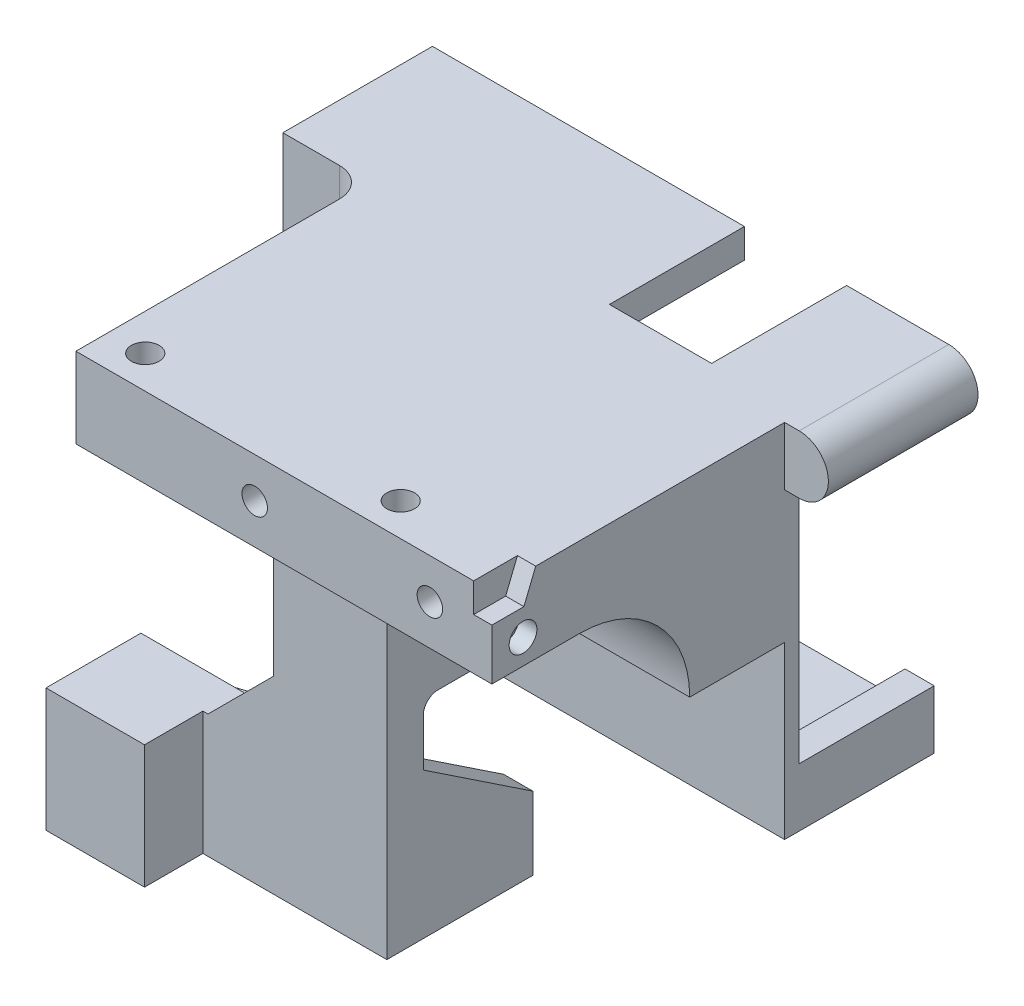
from build123d import *

# Parameters (mm, degrees)
RESSALTO_EXTRUS_O1_DEPTH  = 5
RESSALTO_EXTRUS_O2_DEPTH  = 15.5
RESSALTO_EXTRUS_O3_DEPTH  = 15.5
RESSALTO_EXTRUS_O4_DEPTH  = 20
ESBO_O6_W                 = 5
ESBO_O6_H                 = 16.897720337
RESSALTO_EXTRUS_O5_DEPTH  = 23.2
ESBO_O7_W                 = 13.499987793
ESBO_O7_H                 = 16.897720337
RESSALTO_EXTRUS_O6_DEPTH  = 8
ESBO_O8_W                 = 2.000000014
ESBO_O8_H                 = 6.588073731
CORTE_EXTRUS_O1_DEPTH     = 93.188310305
CHANFRO2_SIZE             = 9
RESSALTO_EXTRUS_O8_DEPTH  = 4.5
RESSALTO_EXTRUS_O7_START  = -5.5
RESSALTO_EXTRUS_O7_DEPTH  = 6
CORTE_EXTRUS_O2_REACH     = 102.674
ESBO_O11_W                = 11.999984741
ESBO_O11_H                = 13.640792847
CORTE_EXTRUS_O4_REACH     = 108.65
ESBO_O13_R                = 1.6
RESSALTO_EXTRUS_O9_DEPTH  = 5
ESBO_O16_W                = 11.500915527
ESBO_O16_H                = 13.642723083
CORTE_EXTRUS_O5_DEPTH     = 101.673633611
RESSALTO_EXTRUS_O13_START = -15.5
ESBO_O18_W                = 32.102264404
ESBO_O18_H                = 11
RESSALTO_EXTRUS_O13_DEPTH = 77.5
ESBO_O27_W                = 32.102264404
ESBO_O27_H                = 11
CORTE_EXTRUS_O8_DEPTH     = 20.5
ESBO_O29_R                = 1.9
CORTE_EXTRUS_O9_DEPTH     = 2.5
ESBO_O30_R                = 1.9
CORTE_EXTRUS_O10_DEPTH    = 6
ESBO_O32_W                = 20
ESBO_O32_H                = 78
CORTE_EXTRUS_O11_DEPTH    = 88.462468019
ESBO_O33_R                = 1.75
CORTE_EXTRUS_O12_DEPTH    = 26
CORTE_EXTRUS_O13_START    = -6
CORTE_EXTRUS_O13_DEPTH    = 2.9
RESSALTO_EXTRUS_O20_DEPTH = 10
ESBO_O40_W                = 68.75
ESBO_O40_H                = 49.5
ESBO_O40_W_2              = 60.75
ESBO_O40_H_2              = 41.5
RESSALTO_EXTRUS_O21_DEPTH = 18.5
ESBO_O41_W                = 11.75
ESBO_O41_H                = 49.5
ESBO_O41_W_2              = 41.5
ESBO_O41_H_2              = 38.5
RESSALTO_EXTRUS_O22_DEPTH = 2
RESSALTO_EXTRUS_O23_DEPTH = 15.5
ESBO_O43_W                = 4
ESBO_O43_H                = 33.5
ESBO_O43_W_2              = 14
ESBO_O43_H_2              = 4
CORTE_EXTRUS_O14_DEPTH    = 18.5
RESSALTO_EXTRUS_O24_DEPTH = 20.5
ESBO_O45_R                = 1.8
CORTE_EXTRUS_O15_DEPTH    = 6
FILETE1_R                 = 4
FILETE2_R                 = 2


with BuildPart() as part:
    # Esboço2 → Ressalto-extrusão1 (new body)
    with BuildSketch(Plane.XY):
        Polygon((0, 0), (0, -60.9), (-20, -60.9), (-20, -25.9), (-15.5, -15.9), (-15.5, 0), align=None)
    extrude(amount=RESSALTO_EXTRUS_O1_DEPTH)

    # Esboço3 → Ressalto-extrusão2 (add)
    with BuildSketch(Plane(origin=(0, 0, 0), x_dir=(0, 0, -1), z_dir=(1, 0, 0))):
        with BuildLine():
            ThreePointArc((6.102294922, 14.1), (-2.871049482, 9.744626932), (-5, 0))
            Line((-5, 0), (0, 0))
            ThreePointArc((0, 0), (1.788130128, 4.313492501), (6.102294922, 6.1))
            Line((6.102294922, 6.1), (30.102294922, 6.1))
            ThreePointArc((30.102294922, 6.099999986), (40.781022689, 1.676452573), (45.204559313, -9.002279663))
            Line((45.204559326, -9.002279663), (45.204559326, -60.9))
            Line((45.204559326, -60.9), (50.204559326, -60.9))
            Line((50.204559326, -60.9), (50.204559326, 14.1))
            Line((50.204559326, 14.1), (6.102294922, 14.1))
        make_face()
    extrude(amount=-RESSALTO_EXTRUS_O2_DEPTH)

    # Esboço4 → Ressalto-extrusão3 (add)
    with BuildSketch(Plane.ZY.offset(15.5)):
        Polygon((-50.204559326, -60.9), (-50.204559326, -40.9), (-65.204559326, -50.9), (-65.204559326, -60.9), align=None)
    extrude(amount=-RESSALTO_EXTRUS_O3_DEPTH)

    # Esboço5 → Ressalto-extrusão4 (add)
    with BuildSketch(Plane.ZY.offset(20)):
        Polygon((5, -60.9), (20, -60.9), (20, -50.9), (5, -40.9), align=None)
    extrude(amount=-RESSALTO_EXTRUS_O4_DEPTH)

    # Esboço6 → Ressalto-extrusão5 (add)
    with BuildSketch(Plane.ZY.offset(15.5)):
        with Locations((-47.704559326, -52.451139832)):
            Rectangle(ESBO_O6_W, ESBO_O6_H)
    extrude(amount=RESSALTO_EXTRUS_O5_DEPTH)

    # Esboço7 → Ressalto-extrusão6 (add)
    with BuildSketch(Plane.XY.offset(-45.204559326)):
        with Locations((-31.950006104, -52.451139832)):
            Rectangle(ESBO_O7_W, ESBO_O7_H)
    extrude(amount=RESSALTO_EXTRUS_O6_DEPTH)

    # Esboço8 → Corte-extrusão1 (cut, through all)
    with BuildSketch(Plane.ZY.offset(15.5)):
        with Locations((-46.204559319, -12.296316529)):
            Rectangle(ESBO_O8_W, ESBO_O8_H)
    extrude(amount=-CORTE_EXTRUS_O1_DEPTH, mode=Mode.SUBTRACT)

    # Chanfro2
    # the kernel refuses this chamfer: 9 mm, written as the material it adds along each edge
    with BuildSketch(Plane(origin=(-15.5, -44.002279663, -50.204559326), x_dir=(0.027495876610586407, 0.9996219169112969, 0), z_dir=(0, 0, 1))) as chanfro2_piece_1:
        Polygon((CHANFRO2_SIZE * 0.999621916911, CHANFRO2_SIZE * 0.0274958766106), (-CHANFRO2_SIZE * 0.0274958766106, CHANFRO2_SIZE * 0.999621916911), (0, 0), align=None)
    extrude(amount=5)

    # Esboço10 → Ressalto-extrusão8 (add)
    with BuildSketch(Plane.ZY.offset(15.5)):
        Polygon((-50.204559326, -40.9), (-50.204559326, -60.9), (-65.204559326, -60.9), (-65.204559326, -50.9), align=None)
    extrude(amount=RESSALTO_EXTRUS_O8_DEPTH)

    # Esboço9 → Ressalto-extrusão7 (add)
    with BuildSketch(Plane.XZ.offset(60.9).offset(RESSALTO_EXTRUS_O7_START)):
        Polygon((-38.7, -50.204559326), (-38.700004578, -53.204559326), (-20, -59.204559326), (-20, -50.204559326), align=None)
    extrude(amount=-RESSALTO_EXTRUS_O7_DEPTH)

    # Corte-extrusão2: up to this face of the body (flat: up to its plane)
    corte_extrus_o2_end = Plane(part.part.faces().sort_by_distance((-10, -45.9, 12.5))[0])
    # Esboço11 → Corte-extrusão2 (cut, up to the picked face)
    with BuildSketch(Plane.XY.offset(5), mode=Mode.PRIVATE) as corte_extrus_o2_sk1:
        with Locations((-10.00000763, -47.720396424)):
            Rectangle(ESBO_O11_W, ESBO_O11_H)
    corte_extrus_o2_tool1 = split(extrude(corte_extrus_o2_sk1.sketch, amount=CORTE_EXTRUS_O2_REACH, mode=Mode.PRIVATE), bisect_by=corte_extrus_o2_end, keep=Keep.BOTH, mode=Mode.PRIVATE)
    add(corte_extrus_o2_tool1.solids().sort_by(Axis((-10.000008, -47.720396, 5), (0, 0, 1)))[0], mode=Mode.SUBTRACT)

    # Esboço13 → Corte-extrusão4 (cut, up to next)
    with BuildSketch(Plane.XZ.offset(60.9), mode=Mode.PRIVATE) as corte_extrus_o4_sk1:
        with Locations(Location((-10, 12.5, 0), (0, 0, 270))):
            Circle(ESBO_O13_R)
    corte_extrus_o4_tool1 = extrude(corte_extrus_o4_sk1.sketch, amount=-CORTE_EXTRUS_O4_REACH, mode=Mode.PRIVATE) & part.part
    # Esboço13 → Corte-extrusão4 (cut, up to next)
    with BuildSketch(Plane.XZ.offset(60.9), mode=Mode.PRIVATE) as corte_extrus_o4_sk2:
        with Locations(Location((-9.7, -57.704559326, 0), (0, 0, 270))):
            Circle(ESBO_O13_R)
    corte_extrus_o4_tool2 = extrude(corte_extrus_o4_sk2.sketch, amount=-CORTE_EXTRUS_O4_REACH, mode=Mode.PRIVATE) & part.part
    add(corte_extrus_o4_tool1.solids().sort_by_distance((-10, -60.9, 12.5))[0], mode=Mode.SUBTRACT)
    add(corte_extrus_o4_tool2.solids().sort_by_distance((-9.7, -60.9, -57.704559))[0], mode=Mode.SUBTRACT)

    # Esboço14 → Ressalto-extrusão9 (add)
    with BuildSketch(Plane.XY.offset(5)):
        Polygon((-10.75, 0), (-4.75, 0), (-4.75, -15.9), (-7.000007629, -25.9), (-7.000007629, -40.9), (-13.000007629, -40.9), (-13.000007629, -25.9), (-10.75, -15.9), align=None)
    extrude(amount=RESSALTO_EXTRUS_O9_DEPTH)

    # Esboço16 → Corte-extrusão5 (cut, through all)
    with BuildSketch(Plane(origin=(0, 0, -50.204559326), x_dir=(-1, 0, 0), z_dir=(0, 0, -1))):
        with Locations((9.750457764, -47.721361542)):
            Rectangle(ESBO_O16_W, ESBO_O16_H)
    extrude(amount=CORTE_EXTRUS_O5_DEPTH, mode=Mode.SUBTRACT)

    # Esboço18 → Ressalto-extrusão13 (add)
    with BuildSketch(Plane(origin=(0, 0, 0), x_dir=(0, 0, -1), z_dir=(1, 0, 0)).offset(RESSALTO_EXTRUS_O13_START)):
        with Locations((34.153427124, 11.6)):
            Rectangle(ESBO_O18_W, ESBO_O18_H)
    extrude(amount=RESSALTO_EXTRUS_O13_DEPTH)

    # Esboço27 → Corte-extrusão8 (cut)
    with BuildSketch(Plane(origin=(62, 0, 0), x_dir=(0, 0, -1), z_dir=(1, 0, 0))):
        with Locations((34.153427124, 11.6)):
            Rectangle(ESBO_O27_W, ESBO_O27_H)
    extrude(amount=-CORTE_EXTRUS_O8_DEPTH, mode=Mode.SUBTRACT)

    # Esboço29 → Corte-extrusão9 (cut)
    with BuildSketch(Plane(origin=(41.5, 0, 0), x_dir=(0, 0, -1), z_dir=(1, 0, 0))):
        with Locations((22.364620491, 9.524231873)):
            Circle(ESBO_O29_R)
        Polygon((24.102294922, 17.1), (22.486408956, 13.10054189), (18.102294922, 13.10054189), (18.102294922, 17.1), align=None)
    extrude(amount=-CORTE_EXTRUS_O9_DEPTH, mode=Mode.SUBTRACT)

    # Esboço30 → Corte-extrusão10 (cut)
    with BuildSketch(Plane(origin=(0, 17.1, 0), x_dir=(1, 0, 0), z_dir=(0, 1, 0))):
        with Locations(Location((-10.5, 22.602294922, 0), (0, 0, 180))):
            Circle(ESBO_O30_R)
        with Locations(Location((24.5, 22.602294922, 0), (0, 0, 180))):
            Circle(ESBO_O30_R)
    extrude(amount=-CORTE_EXTRUS_O10_DEPTH, mode=Mode.SUBTRACT)

    # Esboço32 → Corte-extrusão11 (cut, through all)
    with BuildSketch(Plane.XY.offset(-18.102294922)):
        with Locations((-10, -21.9)):
            Rectangle(ESBO_O32_W, ESBO_O32_H)
    extrude(amount=CORTE_EXTRUS_O11_DEPTH, mode=Mode.SUBTRACT)

    # Esboço33 → Corte-extrusão12 (cut)
    with BuildSketch(Plane.XY.offset(-18.102294922)):
        with Locations((9, 11.6)):
            Circle(ESBO_O33_R)
        with Locations((33, 11.6)):
            Circle(ESBO_O33_R)
    extrude(amount=-CORTE_EXTRUS_O12_DEPTH, mode=Mode.SUBTRACT)

    # Esboço34 → Corte-extrusão13 (cut)
    with BuildSketch(Plane.XY.offset(-18.102294922).offset(CORTE_EXTRUS_O13_START)):
        Polygon((9, 15.179571669), (5.9, 13.389785834), (5.9, 9.810214166), (5.9, 6.1), (12.1, 6.1), (12.1, 9.810214166), (12.1, 13.389785834), align=None)
        Polygon((29.9, 6.1), (29.9, 9.810214166), (29.9, 13.389785834), (33, 15.179571669), (36.1, 13.389785834), (36.1, 9.810214166), (36.1, 6.1), align=None)
    extrude(amount=-CORTE_EXTRUS_O13_DEPTH, mode=Mode.SUBTRACT)

    # Esboço39 → Ressalto-extrusão20 (add)
    with BuildSketch(Plane(origin=(0, 0, -50.204559326), x_dir=(-1, 0, 0), z_dir=(0, 0, -1))):
        Polygon((-41.5, 17.1), (-41.5, 6.1), (0, 6.1), (0, -32.4), (15.5, -32.4), (15.5, 17.1), align=None)
    extrude(amount=RESSALTO_EXTRUS_O20_DEPTH)

    # Esboço40 → Ressalto-extrusão21 (add)
    with BuildSketch(Plane(origin=(0, 0, -60.204559326), x_dir=(-1, 0, 0), z_dir=(0, 0, -1))):
        with Locations((-7.125, -7.65)):
            Rectangle(ESBO_O40_W, ESBO_O40_H)
        with Locations((-7.125, -7.65)):
            Rectangle(ESBO_O40_W_2, ESBO_O40_H_2, mode=Mode.SUBTRACT)
    extrude(amount=RESSALTO_EXTRUS_O21_DEPTH)

    # Esboço41 → Ressalto-extrusão22 (add)
    with BuildSketch(Plane.XY.offset(-60.204559326)):
        with Locations((-21.375, -7.65)):
            Rectangle(ESBO_O41_W, ESBO_O41_H)
        with Locations((20.75, -13.15)):
            Rectangle(ESBO_O41_W_2, ESBO_O41_H_2)
    extrude(amount=RESSALTO_EXTRUS_O22_DEPTH)

    # Esboço42 → Ressalto-extrusão23 (add)
    with BuildSketch(Plane(origin=(41.5, 0, 0), x_dir=(0, 0, -1), z_dir=(1, 0, 0))):
        with BuildLine():
            Line((45.204559312, -9.002279663), (58.204559326, -9.002279663))
            Line((58.204559326, -9.002279663), (58.204559326, 6.1))
            Line((58.204559326, 6.1), (30.101642126, 6.1))
            ThreePointArc((30.101642126, 6.1), (40.780791888, 1.676683369), (45.204559312, -9.002279663))
        make_face()
    extrude(amount=-RESSALTO_EXTRUS_O23_DEPTH)

    # Esboço43 → Corte-extrusão14 (cut)
    with BuildSketch(Plane(origin=(0, 0, -78.704559326), x_dir=(-1, 0, 0), z_dir=(0, 0, -1))):
        with Locations((-39.5, -7.65)):
            Rectangle(ESBO_O43_W, ESBO_O43_H)
        with Locations((25.25, -7.65)):
            Rectangle(ESBO_O43_W, ESBO_O43_H)
        with Locations((-22.5, 15.1)):
            Rectangle(ESBO_O43_W_2, ESBO_O43_H_2)
    extrude(amount=-CORTE_EXTRUS_O14_DEPTH, mode=Mode.SUBTRACT)

    # Esboço44 → Ressalto-extrusão24 (add)
    with BuildSketch(Plane(origin=(0, 0, -78.704559326), x_dir=(-1, 0, 0), z_dir=(0, 0, -1))):
        with BuildLine():
            Line((-43.5, 17.1), (-41.5, 17.1))
            Line((-41.5, 17.1), (-41.5, 9.1))
            Line((-41.5, 9.1), (-43.5, 9.1))
            ThreePointArc((-43.5, 9.1), (-47.5, 13.1), (-43.5, 17.1))
        make_face()
        with BuildLine():
            Line((29.25, -24.4), (27.25, -24.4))
            Line((27.25, -24.4), (27.25, -32.4))
            Line((27.25, -32.4), (29.25, -32.4))
            ThreePointArc((29.25, -32.4), (33.25, -28.4), (29.25, -24.4))
        make_face()
    extrude(amount=-RESSALTO_EXTRUS_O24_DEPTH)

    # Esboço45 → Corte-extrusão15 (cut)
    with BuildSketch(Plane(origin=(0, 0, -78.704559326), x_dir=(-1, 0, 0), z_dir=(0, 0, -1))):
        with Locations(Location((-43.5, 13.1, 0), (0, 0, 90))):
            Circle(ESBO_O45_R)
        with Locations(Location((29.25, -28.4, 0), (0, 0, 90))):
            Circle(ESBO_O45_R)
    extrude(amount=-CORTE_EXTRUS_O15_DEPTH, mode=Mode.SUBTRACT)

    # Filete1
    filete1_edges = [part.edges().sort_by_distance(p)[0] for p in [
        (-15.5, -7.65, -58.204559326),
    ]]
    fillet(filete1_edges, radius=FILETE1_R)

    # Filete2
    filete2_edges = [part.edges().sort_by_distance(p)[0] for p in [
        (-7.75, -32.4, -50.204559326),
    ]]
    fillet(filete2_edges, radius=FILETE2_R)


solid = part.part
